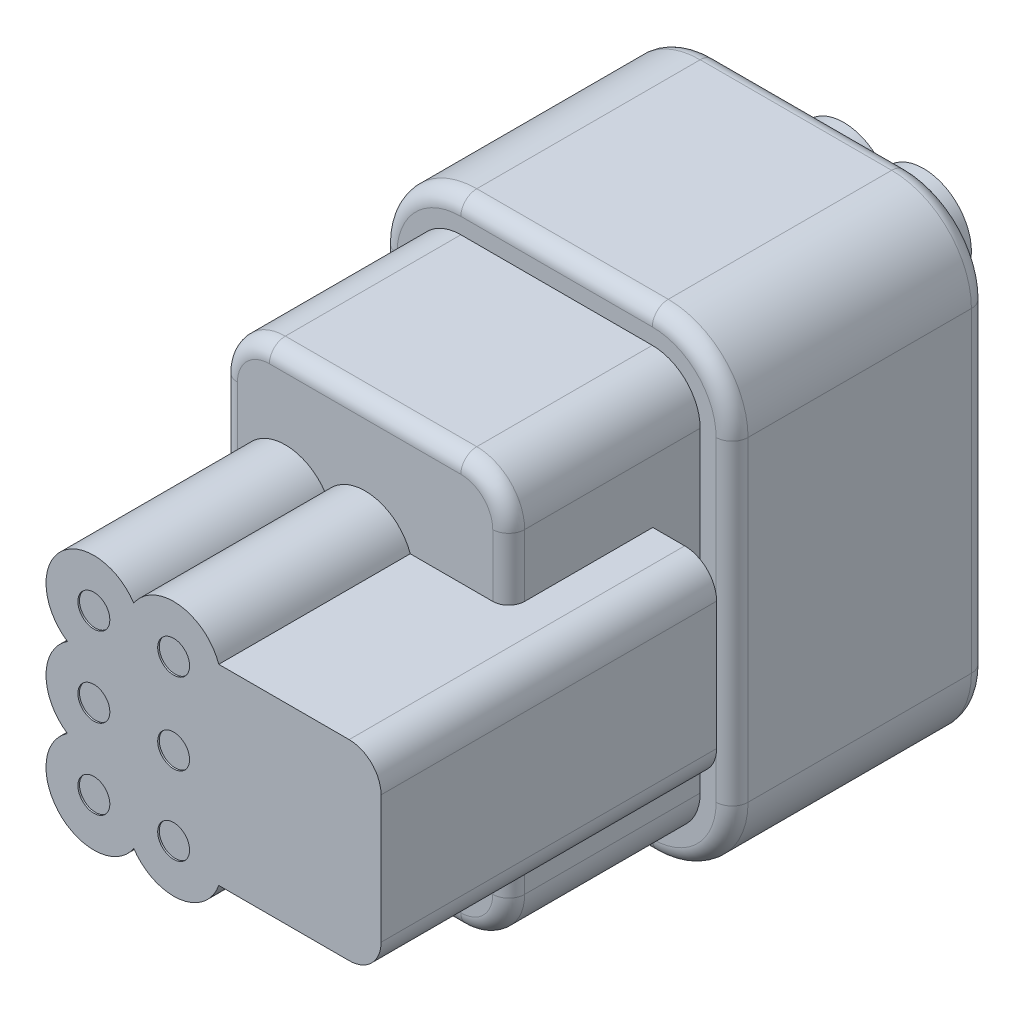
from build123d import *

# Parameters (mm, degrees)
EXTRUDE_1_DEPTH      = 16
EXTRUDE_2_DEPTH      = 12
EXTRUDE_3_DEPTH      = 12
EXTRUDE_3_DEPTH_BACK = 35
FILLET_1_R           = 1
EXTRUDE_4_DEPTH      = 4
EXTRUDE_4_DEPTH_BACK = 12
FILLET_2_R           = 2
SKETCH_5_R           = 1.5
CUT_EXTRUDE_1_DEPTH  = 0.1
SKETCH_6_R           = 1
CUT_EXTRUDE_2_DEPTH  = 0.1


with BuildPart() as part:
    # ｽｹｯﾁ1 → ﾎﾞｽ - 押し出し1 (new body)
    with BuildSketch(Plane.XY):
        with BuildLine():
            Line((5, 0), (17, 0))
            ThreePointArc((17, 0), (20.535533906, 1.464466094), (22, 5))
            Line((22, 5), (22, 24.8))
            ThreePointArc((22, 24.8), (20.535533906, 28.335533906), (17, 29.8))
            Line((17, 29.8), (5, 29.8))
            ThreePointArc((5, 29.8), (1.464466094, 28.335533906), (0, 24.8))
            Line((0, 24.8), (0, 5))
            ThreePointArc((0, 5), (1.464466094, 1.464466094), (5, 0))
        make_face()
    extrude(amount=EXTRUDE_1_DEPTH)

    # ｽｹｯﾁ2 → ﾎﾞｽ - 押し出し2 (add)
    with BuildSketch(Plane.XY.offset(16)):
        with BuildLine():
            Line((17, 27.8), (5, 27.8))
            ThreePointArc((5, 27.8), (2.878679656, 26.921320344), (2, 24.8))
            Line((2, 24.8), (2, 5))
            ThreePointArc((2, 5), (2.878679656, 2.878679656), (5, 2))
            Line((5, 2), (17, 2))
            ThreePointArc((17, 2), (19.121320344, 2.878679656), (20, 5))
            Line((20, 5), (20, 24.8))
            ThreePointArc((20, 24.8), (19.121320344, 26.921320344), (17, 27.8))
        make_face()
    extrude(amount=EXTRUDE_2_DEPTH)

    # ｽｹｯﾁ3 → ﾎﾞｽ - 押し出し3 (add, two sides: drawn at the far end of the back side and taken through both)
    with BuildSketch(Plane.XY.offset(28).offset(-EXTRUDE_3_DEPTH_BACK)):
        with BuildLine():
            ThreePointArc((4.341687605, 12.4), (3, 14.9), (4.341687605, 17.4))
            ThreePointArc((4.341687605, 17.4), (3.878679656, 22.021320344), (8.5, 21.558312395))
            ThreePointArc((8.5, 21.558312395), (13.121320344, 22.021320344), (12.658312395, 17.4))
            ThreePointArc((12.658312395, 17.4), (14, 14.9), (12.658312395, 12.4))
            ThreePointArc((12.658312395, 12.4), (13.121320344, 7.778679656), (8.5, 8.241687605))
            ThreePointArc((8.5, 8.241687605), (3.878679656, 7.778679656), (4.341687605, 12.4))
        make_face()
    extrude(amount=EXTRUDE_3_DEPTH + EXTRUDE_3_DEPTH_BACK)

    # ﾌｨﾚｯﾄ1
    fillet_1_edges = [part.edges().sort_by_distance(p)[0] for p in [
        (1.464466094, 28.335533906, 16),
        (11, 29.8, 0),
        (20.535533906, 28.335533906, 0),
        (0, 14.9, 16),
        (1.464466094, 1.464466094, 16),
        (11, 0, 16),
        (20.535533906, 1.464466094, 16),
        (22, 14.9, 16),
        (19.121320344, 26.921320344, 28),
        (11, 27.8, 28),
        (2.878679656, 26.921320344, 28),
        (2, 14.9, 28),
        (2.878679656, 2.878679656, 28),
        (11, 2, 28),
        (19.121320344, 2.878679656, 28),
        (20, 14.9, 28),
        (20.535533906, 28.335533906, 16),
        (11, 29.8, 16),
        (22, 14.9, 0),
        (20.535533906, 1.464466094, 0),
        (11, 0, 0),
        (1.464466094, 1.464466094, 0),
        (0, 14.9, 0),
        (1.464466094, 28.335533906, 0),
    ]]
    fillet(fillet_1_edges, radius=FILLET_1_R - 0.0001)  # a hair under: the kernel refuses the full size

    # ｽｹｯﾁ4 → ﾎﾞｽ - 押し出し4 (add, two sides: drawn at the far end of the back side and taken through both)
    with BuildSketch(Plane(origin=(20, 0, 0), x_dir=(0, 0, -1), z_dir=(1, 0, 0)).offset(-EXTRUDE_4_DEPTH_BACK)):
        Polygon((-27, 20.9), (-40, 20.9), (-40, 8.9), (-27, 8.9), (-18.970751541, 8.9), (-18.970751541, 20.9), align=None)
    extrude(amount=EXTRUDE_4_DEPTH + EXTRUDE_4_DEPTH_BACK)

    # ﾌｨﾚｯﾄ2
    fillet_2_edges = [part.edges().sort_by_distance(p)[0] for p in [
        (24, 8.9, 29.48537577),
        (24, 20.9, 29.48537577),
    ]]
    fillet(fillet_2_edges, radius=FILLET_2_R)

    # ｽｹｯﾁ5 → ｶｯﾄ - 押し出し1 (cut)
    with BuildSketch(Plane(origin=(0, 0, -7), x_dir=(-1, 0, 0), z_dir=(0, 0, -1))):
        with Locations((-11, 19.9)):
            Circle(SKETCH_5_R)
        with Locations((-11, 14.9)):
            Circle(SKETCH_5_R)
        with Locations((-11, 9.9)):
            Circle(SKETCH_5_R)
        with Locations((-6, 19.9)):
            Circle(SKETCH_5_R)
        with Locations((-6, 14.9)):
            Circle(SKETCH_5_R)
        with Locations((-6, 9.9)):
            Circle(SKETCH_5_R)
    extrude(amount=-CUT_EXTRUDE_1_DEPTH, mode=Mode.SUBTRACT)

    # ｽｹｯﾁ6 → ｶｯﾄ - 押し出し2 (cut)
    with BuildSketch(Plane.XY.offset(40)):
        with Locations((11, 19.9)):
            Circle(SKETCH_6_R)
        with Locations((11, 14.811145862)):
            Circle(SKETCH_6_R)
        with Locations((11, 9.9)):
            Circle(SKETCH_6_R)
        with Locations((6, 19.9)):
            Circle(SKETCH_6_R)
        with Locations((6, 14.9)):
            Circle(SKETCH_6_R)
        with Locations((6, 9.9)):
            Circle(SKETCH_6_R)
    extrude(amount=-CUT_EXTRUDE_2_DEPTH, mode=Mode.SUBTRACT)


solid = part.part
